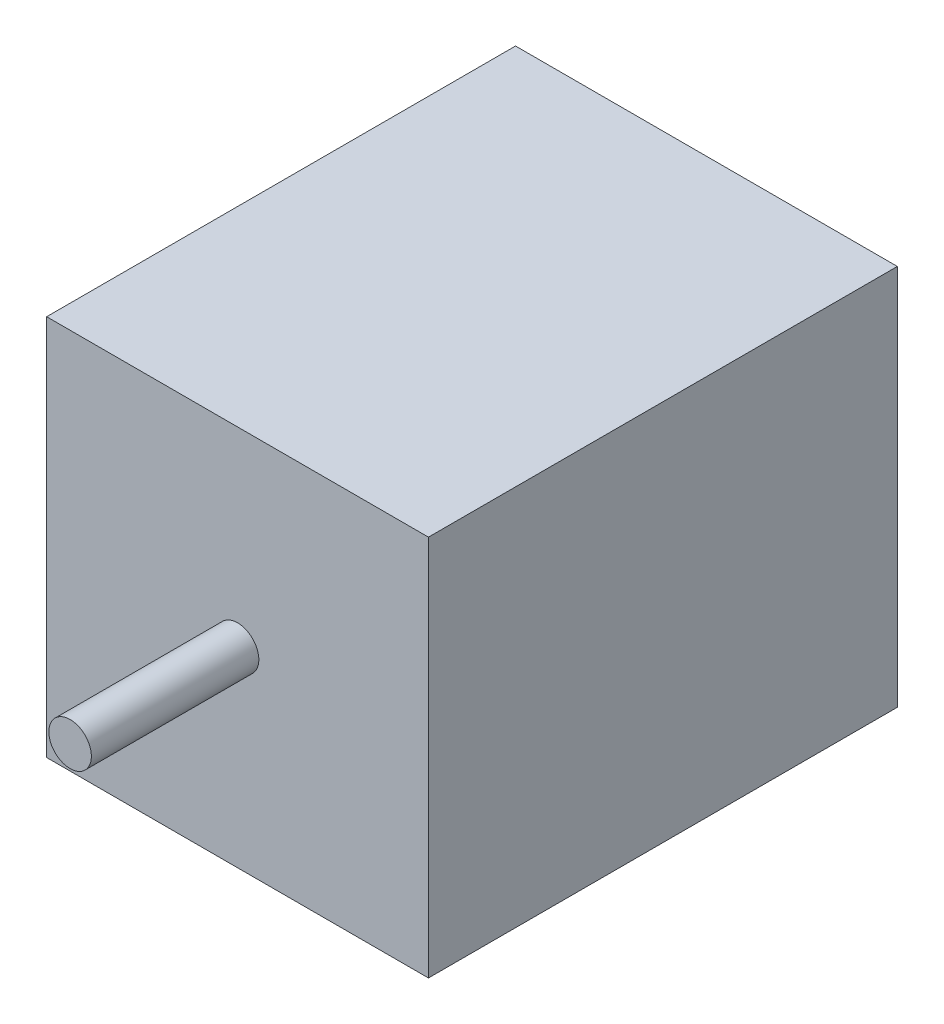
from build123d import *

# Parameters (mm, degrees)
SKETCH1_W           = 57
SKETCH1_H           = 57
BOSS_EXTRUDE1_DEPTH = 35
SKETCH2_R           = 3.175
BOSS_EXTRUDE2_DEPTH = 25


with BuildPart() as part:
    # Sketch1 → Boss-Extrude1 (new, symmetric)
    with BuildSketch(Plane.XY):
        Rectangle(SKETCH1_W, SKETCH1_H)
    extrude(amount=BOSS_EXTRUDE1_DEPTH, both=True)

    # Sketch2 → Boss-Extrude2 (add)
    with BuildSketch(Plane.XY.offset(35)):
        Circle(SKETCH2_R)
    extrude(amount=BOSS_EXTRUDE2_DEPTH)


solid = part.part
